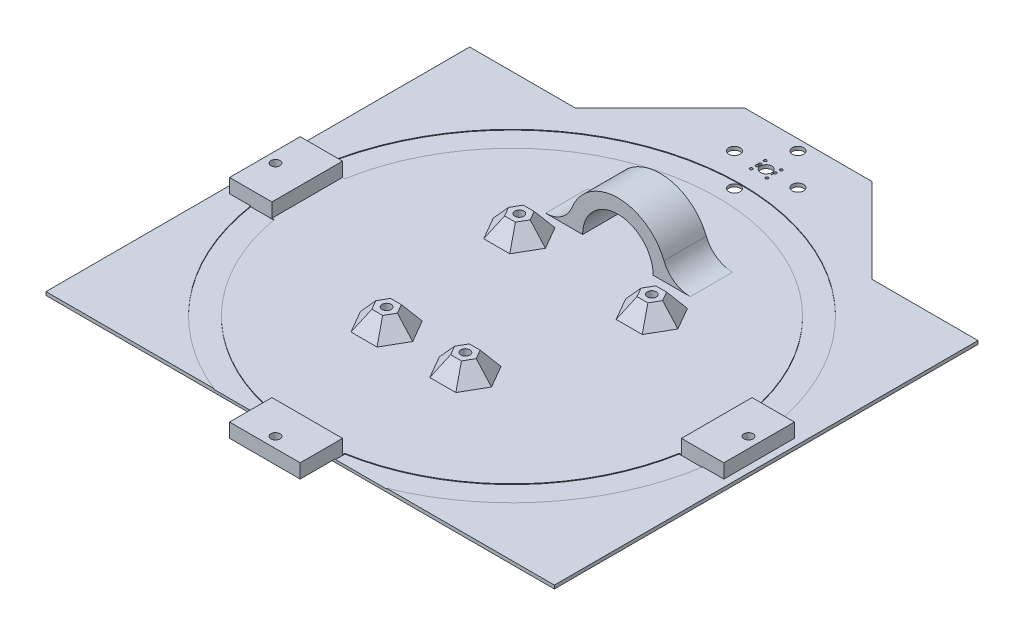
from build123d import *

# Parameters (mm, degrees)
SKETCH1_W                = 180
SKETCH1_H                = 150
BOSS_EXTRUDE1_DEPTH      = 1.2
BOSS_EXTRUDE2_DEPTH      = 6
CHAMFER1_SIZE            = 5
CHAMFER1_SIZE_2          = 6.399708161
SKETCH3_R                = 1.6
CUT_EXTRUDE1_DEPTH       = 5
SKETCH4_W                = 15
SKETCH4_H                = 25
SKETCH4_R                = 1.6
SKETCH4_W_2              = 25
SKETCH4_H_2              = 15
BOSS_EXTRUDE3_DEPTH      = 5
CUT_EXTRUDE2_DEPTH       = 0.25
BOSS_EXTRUDE4_DEPTH      = 7.5
BOSS_EXTRUDE4_DEPTH_BACK = 7.5
FILLET1_R                = 10
CUT_EXTRUDE3_REACH       = 141.552
SKETCH7_R                = 2
SKETCH7_R_2              = 0.5


with BuildPart() as part:
    # Sketch1 → Boss-Extrude1 (new body)
    with BuildSketch(Plane(origin=(0, 0, 0), x_dir=(1, 0, 0), z_dir=(0, 1, 0))):
        Rectangle(SKETCH1_W, SKETCH1_H)
        Polygon((-52.5, 75), (0, 75), (0, 105), (-22.5, 105), align=None)
        Polygon((0, 105), (0, 75), (52.5, 75), (22.5, 105), align=None)
    extrude(amount=BOSS_EXTRUDE1_DEPTH)

    # Sketch2 → Boss-Extrude2 (add)
    with BuildSketch(Plane(origin=(0, 1.2, 0), x_dir=(1, 0, 0), z_dir=(0, 1, 0))):
        Polygon((27.564101615, 25.4), (25.832050808, 28.4), (22.367949192, 28.4), (20.635898385, 25.4), (22.367949192, 22.4), (25.832050808, 22.4), align=None)
        Polygon((-20.635898385, 26.7), (-22.367949192, 29.7), (-25.832050808, 29.7), (-27.564101615, 26.7), (-25.832050808, 23.7), (-22.367949192, 23.7), align=None)
        Polygon((-15.535898385, -25.4), (-17.267949192, -22.4), (-20.732050808, -22.4), (-22.464101615, -25.4), (-20.732050808, -28.4), (-17.267949192, -28.4), align=None)
        Polygon((12.364101615, -25.4), (10.632050808, -22.4), (7.167949192, -22.4), (5.435898385, -25.4), (7.167949192, -28.4), (10.632050808, -28.4), align=None)
    extrude(amount=BOSS_EXTRUDE2_DEPTH)

    # Chamfer1
    # the kernel refuses this chamfer: 6.399708161, 5 mm, written as the material it adds along each edge
    with BuildSketch(Plane(origin=(-2.818240039, 1.2, 11.103412877), x_dir=(-0.8660254037844387, 0, 0.5), z_dir=(0.5, 0, 0.8660254037844387))) as chamfer1_piece_1_section:
        Polygon((CHAMFER1_SIZE, 0), (0, -CHAMFER1_SIZE_2), (0, 0), align=None)
    chamfer1_piece_1 = extrude(amount=36.480655312, mode=Mode.PRIVATE)
    chamfer1_piece_1 = split(chamfer1_piece_1, bisect_by=Plane(origin=(-2.818240039, 7.2, 11.103412877), z_dir=(0, -1, 0)), keep=Keep.TOP, mode=Mode.PRIVATE)
    chamfer1_piece_1 = split(chamfer1_piece_1, bisect_by=Plane(origin=(2.181166612, -3.310219377, 13.989821652), z_dir=(0.6824373310787425, -0.6156614753256566, 0.3940053768033616)), keep=Keep.TOP, mode=Mode.PRIVATE)
    chamfer1_piece_1 = split(chamfer1_piece_1, bisect_by=Plane(origin=(-2.818240039, 12.017141598, 24.948722749), z_dir=(0, -0.6156614753256563, -0.7880107536067237)), keep=Keep.TOP, mode=Mode.PRIVATE)
    add(chamfer1_piece_1)
    with BuildSketch(Plane(origin=(15.422087617, 1.2, 8.103412877), x_dir=(-0.8660254037844387, 0, -0.4999999999999999), z_dir=(-0.4999999999999999, 0, 0.8660254037844388))) as chamfer1_piece_2_section:
        Polygon((CHAMFER1_SIZE, 0), (0, -CHAMFER1_SIZE_2), (0, 0), align=None)
    chamfer1_piece_2 = extrude(amount=36.480655312, mode=Mode.PRIVATE)
    chamfer1_piece_2 = split(chamfer1_piece_2, bisect_by=Plane(origin=(15.422087617, 7.2, 8.103412877), z_dir=(0, -1, 0)), keep=Keep.TOP, mode=Mode.PRIVATE)
    chamfer1_piece_2 = split(chamfer1_piece_2, bisect_by=Plane(origin=(15.422087617, -3.310219377, 13.876230428), z_dir=(0, -0.6156614753256565, 0.7880107536067235)), keep=Keep.TOP, mode=Mode.PRIVATE)
    chamfer1_piece_2 = split(chamfer1_piece_2, bisect_by=Plane(origin=(3.431697543, 12.017141598, 15.026067813), z_dir=(0.6824373310787425, -0.6156614753256566, -0.3940053768033616)), keep=Keep.TOP, mode=Mode.PRIVATE)
    add(chamfer1_piece_2)
    with BuildSketch(Plane(origin=(27.140327656, 1.2, 22.4), x_dir=(0, 0, -1), z_dir=(-1, 0, 0))) as chamfer1_piece_3_section:
        Polygon((CHAMFER1_SIZE, 0), (0, -CHAMFER1_SIZE_2), (0, 0), align=None)
    chamfer1_piece_3 = extrude(amount=36.480655312, mode=Mode.PRIVATE)
    chamfer1_piece_3 = split(chamfer1_piece_3, bisect_by=Plane(origin=(27.140327656, 7.2, 22.4), z_dir=(0, -1, 0)), keep=Keep.TOP, mode=Mode.PRIVATE)
    chamfer1_piece_3 = split(chamfer1_piece_3, bisect_by=Plane(origin=(22.140921005, -3.310219377, 25.286408776), z_dir=(-0.6824373310787424, -0.6156614753256568, 0.39400537680336145)), keep=Keep.TOP, mode=Mode.PRIVATE)
    chamfer1_piece_3 = split(chamfer1_piece_3, bisect_by=Plane(origin=(15.149937583, 12.017141598, 15.477345064), z_dir=(0.6824373310787425, -0.6156614753256566, 0.3940053768033616)), keep=Keep.TOP, mode=Mode.PRIVATE)
    add(chamfer1_piece_3)
    with BuildSketch(Plane(origin=(20.618240039, 1.2, 39.696587123), x_dir=(0.8660254037844387, 0, -0.49999999999999983), z_dir=(-0.4999999999999998, 0, -0.8660254037844388))) as chamfer1_piece_4_section:
        Polygon((CHAMFER1_SIZE, 0), (0, -CHAMFER1_SIZE_2), (0, 0), align=None)
    chamfer1_piece_4 = extrude(amount=36.480655312, mode=Mode.PRIVATE)
    chamfer1_piece_4 = split(chamfer1_piece_4, bisect_by=Plane(origin=(20.618240039, 7.2, 39.696587123), z_dir=(0, -1, 0)), keep=Keep.TOP, mode=Mode.PRIVATE)
    chamfer1_piece_4 = split(chamfer1_piece_4, bisect_by=Plane(origin=(20.618240039, 12.017141598, 25.851277251), z_dir=(0, -0.6156614753256565, 0.7880107536067235)), keep=Keep.TOP, mode=Mode.PRIVATE)
    chamfer1_piece_4 = split(chamfer1_piece_4, bisect_by=Plane(origin=(15.618833388, -3.310219377, 36.810178348), z_dir=(-0.6824373310787425, -0.6156614753256566, -0.39400537680336156)), keep=Keep.TOP, mode=Mode.PRIVATE)
    add(chamfer1_piece_4)
    with BuildSketch(Plane(origin=(2.377912383, 1.2, 42.696587123), x_dir=(0.8660254037844387, 0, 0.4999999999999999), z_dir=(0.4999999999999999, 0, -0.8660254037844388))) as chamfer1_piece_5_section:
        Polygon((CHAMFER1_SIZE, 0), (0, -CHAMFER1_SIZE_2), (0, 0), align=None)
    chamfer1_piece_5 = extrude(amount=36.480655312, mode=Mode.PRIVATE)
    chamfer1_piece_5 = split(chamfer1_piece_5, bisect_by=Plane(origin=(2.377912383, 7.2, 42.696587123), z_dir=(0, -1, 0)), keep=Keep.TOP, mode=Mode.PRIVATE)
    chamfer1_piece_5 = split(chamfer1_piece_5, bisect_by=Plane(origin=(14.368302457, 12.017141598, 35.773932187), z_dir=(-0.6824373310787424, -0.6156614753256568, 0.39400537680336145)), keep=Keep.TOP, mode=Mode.PRIVATE)
    chamfer1_piece_5 = split(chamfer1_piece_5, bisect_by=Plane(origin=(2.377912383, -3.310219377, 36.923769572), z_dir=(0, -0.6156614753256563, -0.7880107536067237)), keep=Keep.TOP, mode=Mode.PRIVATE)
    add(chamfer1_piece_5)
    with BuildSketch(Plane(origin=(-9.340327656, 1.2, 28.4), x_dir=(0, 0, 1), z_dir=(1, 0, 0))) as chamfer1_piece_6_section:
        Polygon((CHAMFER1_SIZE, 0), (0, -CHAMFER1_SIZE_2), (0, 0), align=None)
    chamfer1_piece_6 = extrude(amount=36.480655312, mode=Mode.PRIVATE)
    chamfer1_piece_6 = split(chamfer1_piece_6, bisect_by=Plane(origin=(-9.340327656, 7.2, 28.4), z_dir=(0, -1, 0)), keep=Keep.TOP, mode=Mode.PRIVATE)
    chamfer1_piece_6 = split(chamfer1_piece_6, bisect_by=Plane(origin=(-4.340921005, -3.310219377, 25.513591224), z_dir=(0.6824373310787425, -0.6156614753256566, -0.3940053768033616)), keep=Keep.TOP, mode=Mode.PRIVATE)
    chamfer1_piece_6 = split(chamfer1_piece_6, bisect_by=Plane(origin=(2.650062417, 12.017141598, 35.322654936), z_dir=(-0.6824373310787425, -0.6156614753256566, -0.39400537680336156)), keep=Keep.TOP, mode=Mode.PRIVATE)
    add(chamfer1_piece_6)
    with BuildSketch(Plane(origin=(-37.240327656, 1.2, 28.4), x_dir=(0, 0, 1), z_dir=(1, 0, 0))) as chamfer1_piece_7_section:
        Polygon((CHAMFER1_SIZE, 0), (0, -CHAMFER1_SIZE_2), (0, 0), align=None)
    chamfer1_piece_7 = extrude(amount=36.480655312, mode=Mode.PRIVATE)
    chamfer1_piece_7 = split(chamfer1_piece_7, bisect_by=Plane(origin=(-37.240327656, 7.2, 28.4), z_dir=(0, -1, 0)), keep=Keep.TOP, mode=Mode.PRIVATE)
    chamfer1_piece_7 = split(chamfer1_piece_7, bisect_by=Plane(origin=(-25.249937583, 12.017141598, 35.322654936), z_dir=(-0.6824373310786762, -0.6156614753256564, -0.3940053768034766)), keep=Keep.TOP, mode=Mode.PRIVATE)
    chamfer1_piece_7 = split(chamfer1_piece_7, bisect_by=Plane(origin=(-32.240921005, -3.310219377, 25.513591224), z_dir=(0.6824373310787202, -0.6156614753256564, -0.3940053768034006)), keep=Keep.TOP, mode=Mode.PRIVATE)
    add(chamfer1_piece_7)
    with BuildSketch(Plane(origin=(-25.522087617, 1.2, 42.696587123), x_dir=(0.8660254037843544, 0, 0.5000000000001458), z_dir=(0.5000000000001458, 0, -0.8660254037843546))) as chamfer1_piece_8_section:
        Polygon((CHAMFER1_SIZE, 0), (0, -CHAMFER1_SIZE_2), (0, 0), align=None)
    chamfer1_piece_8 = extrude(amount=36.480655312, mode=Mode.PRIVATE)
    chamfer1_piece_8 = split(chamfer1_piece_8, bisect_by=Plane(origin=(-25.522087617, 7.2, 42.696587123), z_dir=(0, -1, 0)), keep=Keep.TOP, mode=Mode.PRIVATE)
    chamfer1_piece_8 = split(chamfer1_piece_8, bisect_by=Plane(origin=(-25.522087617, -3.310219377, 36.923769572), z_dir=(0, -0.6156614753256567, -0.7880107536067232)), keep=Keep.TOP, mode=Mode.PRIVATE)
    chamfer1_piece_8 = split(chamfer1_piece_8, bisect_by=Plane(origin=(-13.531697543, 12.017141598, 35.773932187), z_dir=(-0.6824373310787424, -0.6156614753256564, 0.39400537680336184)), keep=Keep.TOP, mode=Mode.PRIVATE)
    add(chamfer1_piece_8)
    with BuildSketch(Plane(origin=(-7.281759961, 1.2, 39.696587123), x_dir=(0.8660254037844386, 0, -0.5000000000000001), z_dir=(-0.5000000000000001, 0, -0.8660254037844386))) as chamfer1_piece_9_section:
        Polygon((CHAMFER1_SIZE, 0), (0, -CHAMFER1_SIZE_2), (0, 0), align=None)
    chamfer1_piece_9 = extrude(amount=36.480655312, mode=Mode.PRIVATE)
    chamfer1_piece_9 = split(chamfer1_piece_9, bisect_by=Plane(origin=(-7.281759961, 7.2, 39.696587123), z_dir=(0, -1, 0)), keep=Keep.TOP, mode=Mode.PRIVATE)
    chamfer1_piece_9 = split(chamfer1_piece_9, bisect_by=Plane(origin=(-12.281166612, -3.310219377, 36.810178348), z_dir=(-0.6824373310786762, -0.6156614753256564, -0.3940053768034766)), keep=Keep.TOP, mode=Mode.PRIVATE)
    chamfer1_piece_9 = split(chamfer1_piece_9, bisect_by=Plane(origin=(-7.281759961, 12.017141598, 25.851277251), z_dir=(1.6163362940315776e-14, -0.6156614753256565, 0.7880107536067235)), keep=Keep.TOP, mode=Mode.PRIVATE)
    add(chamfer1_piece_9)
    with BuildSketch(Plane(origin=(-0.759672344, 1.2, 22.4), x_dir=(0, 0, -1), z_dir=(-1, 0, 0))) as chamfer1_piece_10_section:
        Polygon((CHAMFER1_SIZE, 0), (0, -CHAMFER1_SIZE_2), (0, 0), align=None)
    chamfer1_piece_10 = extrude(amount=36.480655312, mode=Mode.PRIVATE)
    chamfer1_piece_10 = split(chamfer1_piece_10, bisect_by=Plane(origin=(-0.759672344, 7.2, 22.4), z_dir=(0, -1, 0)), keep=Keep.TOP, mode=Mode.PRIVATE)
    chamfer1_piece_10 = split(chamfer1_piece_10, bisect_by=Plane(origin=(-5.759078995, -3.310219377, 25.286408776), z_dir=(-0.6824373310787424, -0.6156614753256564, 0.39400537680336184)), keep=Keep.TOP, mode=Mode.PRIVATE)
    chamfer1_piece_10 = split(chamfer1_piece_10, bisect_by=Plane(origin=(-12.750062417, 12.017141598, 15.477345064), z_dir=(0.6824373310787266, -0.6156614753256564, 0.3940053768033893)), keep=Keep.TOP, mode=Mode.PRIVATE)
    add(chamfer1_piece_10)
    with BuildSketch(Plane(origin=(-12.477912383, 1.2, 8.103412877), x_dir=(-0.8660254037844184, 0, -0.500000000000035), z_dir=(-0.500000000000035, 0, 0.8660254037844185))) as chamfer1_piece_11_section:
        Polygon((CHAMFER1_SIZE, 0), (0, -CHAMFER1_SIZE_2), (0, 0), align=None)
    chamfer1_piece_11 = extrude(amount=36.480655312, mode=Mode.PRIVATE)
    chamfer1_piece_11 = split(chamfer1_piece_11, bisect_by=Plane(origin=(-12.477912383, 7.2, 8.103412877), z_dir=(0, -1, 0)), keep=Keep.TOP, mode=Mode.PRIVATE)
    chamfer1_piece_11 = split(chamfer1_piece_11, bisect_by=Plane(origin=(-12.477912383, -3.310219377, 13.876230428), z_dir=(1.6163362940315776e-14, -0.6156614753256565, 0.7880107536067235)), keep=Keep.TOP, mode=Mode.PRIVATE)
    chamfer1_piece_11 = split(chamfer1_piece_11, bisect_by=Plane(origin=(-24.468302457, 12.017141598, 15.026067813), z_dir=(0.6824373310787202, -0.6156614753256564, -0.3940053768034006)), keep=Keep.TOP, mode=Mode.PRIVATE)
    add(chamfer1_piece_11)
    with BuildSketch(Plane(origin=(-30.718240039, 1.2, 11.103412877), x_dir=(-0.8660254037844104, 0, 0.5000000000000491), z_dir=(0.5000000000000491, 0, 0.8660254037844103))) as chamfer1_piece_12_section:
        Polygon((CHAMFER1_SIZE, 0), (0, -CHAMFER1_SIZE_2), (0, 0), align=None)
    chamfer1_piece_12 = extrude(amount=36.480655312, mode=Mode.PRIVATE)
    chamfer1_piece_12 = split(chamfer1_piece_12, bisect_by=Plane(origin=(-30.718240039, 7.2, 11.103412877), z_dir=(0, -1, 0)), keep=Keep.TOP, mode=Mode.PRIVATE)
    chamfer1_piece_12 = split(chamfer1_piece_12, bisect_by=Plane(origin=(-30.718240039, 12.017141598, 24.948722749), z_dir=(0, -0.6156614753256567, -0.7880107536067232)), keep=Keep.TOP, mode=Mode.PRIVATE)
    chamfer1_piece_12 = split(chamfer1_piece_12, bisect_by=Plane(origin=(-25.718833388, -3.310219377, 13.989821652), z_dir=(0.6824373310787266, -0.6156614753256564, 0.3940053768033893)), keep=Keep.TOP, mode=Mode.PRIVATE)
    add(chamfer1_piece_12)
    with BuildSketch(Plane(origin=(30.622087617, 1.2, -42.696587123), x_dir=(-0.8660254037844389, 0, -0.49999999999999956), z_dir=(-0.4999999999999995, 0, 0.8660254037844389))) as chamfer1_piece_13_section:
        Polygon((CHAMFER1_SIZE, 0), (0, -CHAMFER1_SIZE_2), (0, 0), align=None)
    chamfer1_piece_13 = extrude(amount=36.480655312, mode=Mode.PRIVATE)
    chamfer1_piece_13 = split(chamfer1_piece_13, bisect_by=Plane(origin=(30.622087617, 7.2, -42.696587123), z_dir=(0, -1, 0)), keep=Keep.TOP, mode=Mode.PRIVATE)
    chamfer1_piece_13 = split(chamfer1_piece_13, bisect_by=Plane(origin=(18.631697543, 12.017141598, -35.773932187), z_dir=(0.6824373310787425, -0.6156614753256566, -0.3940053768033616)), keep=Keep.TOP, mode=Mode.PRIVATE)
    chamfer1_piece_13 = split(chamfer1_piece_13, bisect_by=Plane(origin=(30.622087617, -3.310219377, -36.923769572), z_dir=(0, -0.6156614753256565, 0.7880107536067235)), keep=Keep.TOP, mode=Mode.PRIVATE)
    add(chamfer1_piece_13)
    with BuildSketch(Plane(origin=(12.381759961, 1.2, -39.696587123), x_dir=(-0.8660254037844387, 0, 0.4999999999999999), z_dir=(0.4999999999999999, 0, 0.8660254037844388))) as chamfer1_piece_14_section:
        Polygon((CHAMFER1_SIZE, 0), (0, -CHAMFER1_SIZE_2), (0, 0), align=None)
    chamfer1_piece_14 = extrude(amount=36.480655312, mode=Mode.PRIVATE)
    chamfer1_piece_14 = split(chamfer1_piece_14, bisect_by=Plane(origin=(12.381759961, 7.2, -39.696587123), z_dir=(0, -1, 0)), keep=Keep.TOP, mode=Mode.PRIVATE)
    chamfer1_piece_14 = split(chamfer1_piece_14, bisect_by=Plane(origin=(17.381166612, -3.310219377, -36.810178348), z_dir=(0.6824373310787428, -0.6156614753256567, 0.39400537680336145)), keep=Keep.TOP, mode=Mode.PRIVATE)
    chamfer1_piece_14 = split(chamfer1_piece_14, bisect_by=Plane(origin=(12.381759961, 12.017141598, -25.851277251), z_dir=(0, -0.6156614753256565, -0.7880107536067235)), keep=Keep.TOP, mode=Mode.PRIVATE)
    add(chamfer1_piece_14)
    with BuildSketch(Plane(origin=(5.859672344, 1.2, -22.4), x_dir=(0, 0, 1), z_dir=(1, 0, 0))) as chamfer1_piece_15_section:
        Polygon((CHAMFER1_SIZE, 0), (0, -CHAMFER1_SIZE_2), (0, 0), align=None)
    chamfer1_piece_15 = extrude(amount=36.480655312, mode=Mode.PRIVATE)
    chamfer1_piece_15 = split(chamfer1_piece_15, bisect_by=Plane(origin=(5.859672344, 7.2, -22.4), z_dir=(0, -1, 0)), keep=Keep.TOP, mode=Mode.PRIVATE)
    chamfer1_piece_15 = split(chamfer1_piece_15, bisect_by=Plane(origin=(10.859078995, -3.310219377, -25.286408776), z_dir=(0.6824373310787425, -0.6156614753256566, -0.3940053768033616)), keep=Keep.TOP, mode=Mode.PRIVATE)
    chamfer1_piece_15 = split(chamfer1_piece_15, bisect_by=Plane(origin=(17.850062417, 12.017141598, -15.477345064), z_dir=(-0.6824373310787426, -0.6156614753256564, -0.39400537680336173)), keep=Keep.TOP, mode=Mode.PRIVATE)
    add(chamfer1_piece_15)
    with BuildSketch(Plane(origin=(17.577912383, 1.2, -8.103412877), x_dir=(0.8660254037844387, 0, 0.4999999999999999), z_dir=(0.4999999999999999, 0, -0.8660254037844388))) as chamfer1_piece_16_section:
        Polygon((CHAMFER1_SIZE, 0), (0, -CHAMFER1_SIZE_2), (0, 0), align=None)
    chamfer1_piece_16 = extrude(amount=36.480655312, mode=Mode.PRIVATE)
    chamfer1_piece_16 = split(chamfer1_piece_16, bisect_by=Plane(origin=(17.577912383, 7.2, -8.103412877), z_dir=(0, -1, 0)), keep=Keep.TOP, mode=Mode.PRIVATE)
    chamfer1_piece_16 = split(chamfer1_piece_16, bisect_by=Plane(origin=(17.577912383, -3.310219377, -13.876230428), z_dir=(0, -0.6156614753256565, -0.7880107536067235)), keep=Keep.TOP, mode=Mode.PRIVATE)
    chamfer1_piece_16 = split(chamfer1_piece_16, bisect_by=Plane(origin=(29.568302457, 12.017141598, -15.026067813), z_dir=(-0.6824373310787424, -0.6156614753256564, 0.3940053768033619)), keep=Keep.TOP, mode=Mode.PRIVATE)
    add(chamfer1_piece_16)
    with BuildSketch(Plane(origin=(35.818240039, 1.2, -11.103412877), x_dir=(0.8660254037844385, 0, -0.5000000000000002), z_dir=(-0.5000000000000003, 0, -0.8660254037844386))) as chamfer1_piece_17_section:
        Polygon((CHAMFER1_SIZE, 0), (0, -CHAMFER1_SIZE_2), (0, 0), align=None)
    chamfer1_piece_17 = extrude(amount=36.480655312, mode=Mode.PRIVATE)
    chamfer1_piece_17 = split(chamfer1_piece_17, bisect_by=Plane(origin=(35.818240039, 7.2, -11.103412877), z_dir=(0, -1, 0)), keep=Keep.TOP, mode=Mode.PRIVATE)
    chamfer1_piece_17 = split(chamfer1_piece_17, bisect_by=Plane(origin=(30.818833388, -3.310219377, -13.989821652), z_dir=(-0.6824373310787426, -0.6156614753256564, -0.39400537680336173)), keep=Keep.TOP, mode=Mode.PRIVATE)
    chamfer1_piece_17 = split(chamfer1_piece_17, bisect_by=Plane(origin=(35.818240039, 12.017141598, -24.948722749), z_dir=(0, -0.6156614753256565, 0.7880107536067235)), keep=Keep.TOP, mode=Mode.PRIVATE)
    add(chamfer1_piece_17)
    with BuildSketch(Plane(origin=(42.340327656, 1.2, -28.4), x_dir=(0, 0, -1), z_dir=(-1, 0, 0))) as chamfer1_piece_18_section:
        Polygon((CHAMFER1_SIZE, 0), (0, -CHAMFER1_SIZE_2), (0, 0), align=None)
    chamfer1_piece_18 = extrude(amount=36.480655312, mode=Mode.PRIVATE)
    chamfer1_piece_18 = split(chamfer1_piece_18, bisect_by=Plane(origin=(42.340327656, 7.2, -28.4), z_dir=(0, -1, 0)), keep=Keep.TOP, mode=Mode.PRIVATE)
    chamfer1_piece_18 = split(chamfer1_piece_18, bisect_by=Plane(origin=(30.349937583, 12.017141598, -35.322654936), z_dir=(0.6824373310787428, -0.6156614753256567, 0.39400537680336145)), keep=Keep.TOP, mode=Mode.PRIVATE)
    chamfer1_piece_18 = split(chamfer1_piece_18, bisect_by=Plane(origin=(37.340921005, -3.310219377, -25.513591224), z_dir=(-0.6824373310787424, -0.6156614753256564, 0.3940053768033619)), keep=Keep.TOP, mode=Mode.PRIVATE)
    add(chamfer1_piece_18)
    with BuildSketch(Plane(origin=(-17.577912383, 1.2, -43.996587123), x_dir=(-0.8660254037844387, 0, -0.4999999999999999), z_dir=(-0.4999999999999999, 0, 0.8660254037844388))) as chamfer1_piece_19_section:
        Polygon((CHAMFER1_SIZE, 0), (0, -CHAMFER1_SIZE_2), (0, 0), align=None)
    chamfer1_piece_19 = extrude(amount=36.480655312, mode=Mode.PRIVATE)
    chamfer1_piece_19 = split(chamfer1_piece_19, bisect_by=Plane(origin=(-17.577912383, 7.2, -43.996587123), z_dir=(0, -1, 0)), keep=Keep.TOP, mode=Mode.PRIVATE)
    chamfer1_piece_19 = split(chamfer1_piece_19, bisect_by=Plane(origin=(-17.577912383, -3.310219377, -38.223769572), z_dir=(0, -0.6156614753256565, 0.7880107536067235)), keep=Keep.TOP, mode=Mode.PRIVATE)
    chamfer1_piece_19 = split(chamfer1_piece_19, bisect_by=Plane(origin=(-29.568302457, 12.017141598, -37.073932187), z_dir=(0.6824373310787425, -0.6156614753256564, -0.394005376803362)), keep=Keep.TOP, mode=Mode.PRIVATE)
    add(chamfer1_piece_19)
    with BuildSketch(Plane(origin=(-5.859672344, 1.2, -29.7), x_dir=(0, 0, -1), z_dir=(-1, 0, 0))) as chamfer1_piece_20_section:
        Polygon((CHAMFER1_SIZE, 0), (0, -CHAMFER1_SIZE_2), (0, 0), align=None)
    chamfer1_piece_20 = extrude(amount=36.480655312, mode=Mode.PRIVATE)
    chamfer1_piece_20 = split(chamfer1_piece_20, bisect_by=Plane(origin=(-5.859672344, 7.2, -29.7), z_dir=(0, -1, 0)), keep=Keep.TOP, mode=Mode.PRIVATE)
    chamfer1_piece_20 = split(chamfer1_piece_20, bisect_by=Plane(origin=(-10.859078995, -3.310219377, -26.813591224), z_dir=(-0.682437331078742, -0.6156614753256566, 0.39400537680336195)), keep=Keep.TOP, mode=Mode.PRIVATE)
    chamfer1_piece_20 = split(chamfer1_piece_20, bisect_by=Plane(origin=(-17.850062417, 12.017141598, -36.622654936), z_dir=(0.6824373310787424, -0.615661475325657, 0.3940053768033615)), keep=Keep.TOP, mode=Mode.PRIVATE)
    add(chamfer1_piece_20)
    with BuildSketch(Plane(origin=(-12.381759961, 1.2, -12.403412877), x_dir=(0.8660254037844385, 0, -0.5000000000000004), z_dir=(-0.5000000000000004, 0, -0.8660254037844385))) as chamfer1_piece_21_section:
        Polygon((CHAMFER1_SIZE, 0), (0, -CHAMFER1_SIZE_2), (0, 0), align=None)
    chamfer1_piece_21 = extrude(amount=36.480655312, mode=Mode.PRIVATE)
    chamfer1_piece_21 = split(chamfer1_piece_21, bisect_by=Plane(origin=(-12.381759961, 7.2, -12.403412877), z_dir=(0, -1, 0)), keep=Keep.TOP, mode=Mode.PRIVATE)
    chamfer1_piece_21 = split(chamfer1_piece_21, bisect_by=Plane(origin=(-12.381759961, 12.017141598, -26.248722749), z_dir=(0, -0.6156614753256565, 0.7880107536067235)), keep=Keep.TOP, mode=Mode.PRIVATE)
    chamfer1_piece_21 = split(chamfer1_piece_21, bisect_by=Plane(origin=(-17.381166612, -3.310219377, -15.289821652), z_dir=(-0.6824373310787428, -0.6156614753256568, -0.39400537680336084)), keep=Keep.TOP, mode=Mode.PRIVATE)
    add(chamfer1_piece_21)
    with BuildSketch(Plane(origin=(-30.622087617, 1.2, -9.403412877), x_dir=(0.8660254037844393, 0, 0.49999999999999895), z_dir=(0.499999999999999, 0, -0.8660254037844394))) as chamfer1_piece_22_section:
        Polygon((CHAMFER1_SIZE, 0), (0, -CHAMFER1_SIZE_2), (0, 0), align=None)
    chamfer1_piece_22 = extrude(amount=36.480655312, mode=Mode.PRIVATE)
    chamfer1_piece_22 = split(chamfer1_piece_22, bisect_by=Plane(origin=(-30.622087617, 7.2, -9.403412877), z_dir=(0, -1, 0)), keep=Keep.TOP, mode=Mode.PRIVATE)
    chamfer1_piece_22 = split(chamfer1_piece_22, bisect_by=Plane(origin=(-18.631697543, 12.017141598, -16.326067813), z_dir=(-0.682437331078742, -0.6156614753256566, 0.39400537680336195)), keep=Keep.TOP, mode=Mode.PRIVATE)
    chamfer1_piece_22 = split(chamfer1_piece_22, bisect_by=Plane(origin=(-30.622087617, -3.310219377, -15.176230428), z_dir=(0, -0.6156614753256565, -0.7880107536067235)), keep=Keep.TOP, mode=Mode.PRIVATE)
    add(chamfer1_piece_22)
    with BuildSketch(Plane(origin=(-42.340327656, 1.2, -23.7), x_dir=(0, 0, 1), z_dir=(1, 0, 0))) as chamfer1_piece_23_section:
        Polygon((CHAMFER1_SIZE, 0), (0, -CHAMFER1_SIZE_2), (0, 0), align=None)
    chamfer1_piece_23 = extrude(amount=36.480655312, mode=Mode.PRIVATE)
    chamfer1_piece_23 = split(chamfer1_piece_23, bisect_by=Plane(origin=(-42.340327656, 7.2, -23.7), z_dir=(0, -1, 0)), keep=Keep.TOP, mode=Mode.PRIVATE)
    chamfer1_piece_23 = split(chamfer1_piece_23, bisect_by=Plane(origin=(-37.340921005, -3.310219377, -26.586408776), z_dir=(0.6824373310787425, -0.6156614753256564, -0.394005376803362)), keep=Keep.TOP, mode=Mode.PRIVATE)
    chamfer1_piece_23 = split(chamfer1_piece_23, bisect_by=Plane(origin=(-30.349937583, 12.017141598, -16.777345064), z_dir=(-0.6824373310787428, -0.6156614753256568, -0.39400537680336084)), keep=Keep.TOP, mode=Mode.PRIVATE)
    add(chamfer1_piece_23)
    with BuildSketch(Plane(origin=(-35.818240039, 1.2, -40.996587123), x_dir=(-0.8660254037844385, 0, 0.5000000000000002), z_dir=(0.5000000000000003, 0, 0.8660254037844386))) as chamfer1_piece_24_section:
        Polygon((CHAMFER1_SIZE, 0), (0, -CHAMFER1_SIZE_2), (0, 0), align=None)
    chamfer1_piece_24 = extrude(amount=36.480655312, mode=Mode.PRIVATE)
    chamfer1_piece_24 = split(chamfer1_piece_24, bisect_by=Plane(origin=(-35.818240039, 7.2, -40.996587123), z_dir=(0, -1, 0)), keep=Keep.TOP, mode=Mode.PRIVATE)
    chamfer1_piece_24 = split(chamfer1_piece_24, bisect_by=Plane(origin=(-30.818833388, -3.310219377, -38.110178348), z_dir=(0.6824373310787424, -0.615661475325657, 0.3940053768033615)), keep=Keep.TOP, mode=Mode.PRIVATE)
    chamfer1_piece_24 = split(chamfer1_piece_24, bisect_by=Plane(origin=(-35.818240039, 12.017141598, -27.151277251), z_dir=(0, -0.6156614753256565, -0.7880107536067235)), keep=Keep.TOP, mode=Mode.PRIVATE)
    add(chamfer1_piece_24)

    # Sketch3 → Cut-Extrude1 (cut)
    with BuildSketch(Plane(origin=(0, 7.2, 0), x_dir=(1, 0, 0), z_dir=(0, 1, 0))):
        with Locations(Location((24.1, 25.4, 0), (0, 0, 270))):
            Circle(SKETCH3_R)
        with Locations(Location((-19, -25.4, 0), (0, 0, 270))):
            Circle(SKETCH3_R)
        with Locations(Location((8.9, -25.4, 0), (0, 0, 270))):
            Circle(SKETCH3_R)
        with Locations(Location((-24.1, 26.7, 0), (0, 0, 270))):
            Circle(SKETCH3_R)
    extrude(amount=-CUT_EXTRUDE1_DEPTH, mode=Mode.SUBTRACT)

    # Sketch4 → Boss-Extrude3 (add)
    # profile 1 of 3: a face of its own
    with BuildSketch(Plane(origin=(0, 1.2, 0), x_dir=(1, 0, 0), z_dir=(0, 1, 0))):
        with Locations((80, 0)):
            Rectangle(SKETCH4_W, SKETCH4_H)
        with Locations(Location((83.75, 0, 0), (0, 0, 270))):
            Circle(SKETCH4_R, mode=Mode.SUBTRACT)
    # profile 2 of 3: a face of its own
    with BuildSketch(Plane(origin=(0, 1.2, 0), x_dir=(1, 0, 0), z_dir=(0, 1, 0))):
        with Locations((0, -80)):
            Rectangle(SKETCH4_W_2, SKETCH4_H_2)
        with Locations(Location((0, -83.75, 0), (0, 0, 270))):
            Circle(SKETCH4_R, mode=Mode.SUBTRACT)
    # profile 3 of 3: a face of its own
    with BuildSketch(Plane(origin=(0, 1.2, 0), x_dir=(1, 0, 0), z_dir=(0, 1, 0))):
        with Locations((-80, 0)):
            Rectangle(SKETCH4_W, SKETCH4_H)
        with Locations(Location((-83.75, 0, 0), (0, 0, 270))):
            Circle(SKETCH4_R, mode=Mode.SUBTRACT)
    extrude(amount=BOSS_EXTRUDE3_DEPTH)

    # Sketch5 → Cut-Extrude2 (cut)
    with BuildSketch(Plane(origin=(0, 1.2, 0), x_dir=(1, 0, 0), z_dir=(0, 1, 0))):
        with BuildLine():
            Line((-80.029681994, 12.5), (-71.681918175, 12.5))
            ThreePointArc((-71.681918175, 12.5), (0, 72.763640599), (71.681918175, 12.5))
            Line((71.681918175, 12.5), (80.029681994, 12.5))
            ThreePointArc((80.029681994, 12.5), (0, 81), (-80.029681994, 12.5))
        make_face()
        with BuildLine():
            Line((-71.681918175, -12.5), (-80.029681994, -12.5))
            ThreePointArc((-80.029681994, -12.5), (-63.529274594, -50.249689248), (-30.594117082, -75))
            Line((-30.594117082, -75), (-12.5, -75))
            Line((-12.5, -75), (-12.5, -72.5))
            Line((-12.5, -72.5), (-6.188488771, -72.5))
            ThreePointArc((-6.188488771, -72.5), (-49.152314996, -53.652561204), (-71.681918175, -12.5))
        make_face()
        with BuildLine():
            ThreePointArc((30.594117082, -75), (63.529274594, -50.249689248), (80.029681994, -12.5))
            Line((80.029681994, -12.5), (71.681918175, -12.5))
            ThreePointArc((71.681918175, -12.5), (51.451663692, -51.451663692), (12.5, -71.681918175))
            Line((12.5, -71.681918175), (12.5, -75))
            Line((12.5, -75), (30.594117082, -75))
        make_face()
    extrude(amount=-CUT_EXTRUDE2_DEPTH, mode=Mode.SUBTRACT)

    # Sketch6 → Boss-Extrude4 (add, two sides: drawn at the far end of the back side and taken through both)
    with BuildSketch(Plane(origin=(0, 0, -45), x_dir=(-1, 0, 0), z_dir=(0, 0, -1)).offset(-BOSS_EXTRUDE4_DEPTH_BACK)):
        with BuildLine():
            Line((-17.5, 1.2), (-12.5, 1.2))
            ThreePointArc((-12.5, 1.2), (0, 13.7), (12.5, 1.2))
            Line((12.5, 1.2), (17.5, 1.2))
            ThreePointArc((17.5, 1.2), (0, 18.7), (-17.5, 1.2))
        make_face()
    extrude(amount=BOSS_EXTRUDE4_DEPTH + BOSS_EXTRUDE4_DEPTH_BACK)

    # Fillet1
    fillet1_edges = [part.edges().sort_by_distance(p)[0] for p in [
        (-17.5, 1.2, -45),
        (17.5, 1.2, -45),
    ]]
    fillet(fillet1_edges, radius=FILLET1_R)

    # Cut-Extrude3: up to this face of the body (flat: up to its plane)
    cut_extrude3_end = Plane(part.part.faces().sort_by_distance((-83.75, 1.2, 0))[0])
    # Sketch7 → Cut-Extrude3 (cut, up to the picked face)
    with BuildSketch(Plane.XZ, mode=Mode.PRIVATE) as cut_extrude3_sk1:
        with Locations(Location((11.25, -90, 0), (0, 0, 270))):
            Circle(SKETCH7_R)
    cut_extrude3_tool1 = split(extrude(cut_extrude3_sk1.sketch, amount=-CUT_EXTRUDE3_REACH, mode=Mode.PRIVATE), bisect_by=cut_extrude3_end, keep=Keep.BOTH, mode=Mode.PRIVATE)
    # Sketch7 → Cut-Extrude3 (cut, up to the picked face)
    with BuildSketch(Plane.XZ, mode=Mode.PRIVATE) as cut_extrude3_sk2:
        with Locations(Location((2.842685024, -92.488242874, 0), (0, 0, 270))):
            Circle(SKETCH7_R_2)
    cut_extrude3_tool2 = split(extrude(cut_extrude3_sk2.sketch, amount=-CUT_EXTRUDE3_REACH, mode=Mode.PRIVATE), bisect_by=cut_extrude3_end, keep=Keep.BOTH, mode=Mode.PRIVATE)
    # Sketch7 → Cut-Extrude3 (cut, up to the picked face)
    with BuildSketch(Plane.XZ, mode=Mode.PRIVATE) as cut_extrude3_sk3:
        with Locations(Location((2.842685024, -87.511757126, 0), (0, 0, 90))):
            Circle(SKETCH7_R_2)
    cut_extrude3_tool3 = split(extrude(cut_extrude3_sk3.sketch, amount=-CUT_EXTRUDE3_REACH, mode=Mode.PRIVATE), bisect_by=cut_extrude3_end, keep=Keep.BOTH, mode=Mode.PRIVATE)
    # Sketch7 → Cut-Extrude3 (cut, up to the picked face)
    with BuildSketch(Plane.XZ, mode=Mode.PRIVATE) as cut_extrude3_sk4:
        with BuildLine():
            ThreePointArc((2.621918049, -90), (2.764664942, -90.989446111), (2.671342512, -89.994121437))
            Line((2.671342512, -89.994121437), (2.604245713, -89.017437001))
            ThreePointArc((2.604245713, -89.017437001), (2.551192542, -89.031496776), (2.5, -89.051286669))
            Line((2.5, -89.051286669), (2.5, -89.962821881))
            ThreePointArc((2.5, -89.962821881), (2.559769486, -89.985311788), (2.621918049, -90))
        make_face()
    cut_extrude3_tool4 = split(extrude(cut_extrude3_sk4.sketch, amount=-CUT_EXTRUDE3_REACH, mode=Mode.PRIVATE), bisect_by=cut_extrude3_end, keep=Keep.BOTH, mode=Mode.PRIVATE)
    # Sketch7 → Cut-Extrude3 (cut, up to the picked face)
    with BuildSketch(Plane.XZ, mode=Mode.PRIVATE) as cut_extrude3_sk5:
        with Locations(Location((-2.842685024, -87.511757126, 0), (0, 0, 270))):
            Circle(SKETCH7_R_2)
    cut_extrude3_tool5 = split(extrude(cut_extrude3_sk5.sketch, amount=-CUT_EXTRUDE3_REACH, mode=Mode.PRIVATE), bisect_by=cut_extrude3_end, keep=Keep.BOTH, mode=Mode.PRIVATE)
    # Sketch7 → Cut-Extrude3 (cut, up to the picked face)
    with BuildSketch(Plane.XZ, mode=Mode.PRIVATE) as cut_extrude3_sk6:
        with Locations(Location((-2.842685024, -92.488242874, 0), (0, 0, 90))):
            Circle(SKETCH7_R_2)
    cut_extrude3_tool6 = split(extrude(cut_extrude3_sk6.sketch, amount=-CUT_EXTRUDE3_REACH, mode=Mode.PRIVATE), bisect_by=cut_extrude3_end, keep=Keep.BOTH, mode=Mode.PRIVATE)
    # Sketch7 → Cut-Extrude3 (cut, up to the picked face)
    with BuildSketch(Plane.XZ, mode=Mode.PRIVATE) as cut_extrude3_sk7:
        with Locations(Location((0, -90, 0), (0, 0, 270))):
            Circle(SKETCH7_R)
    cut_extrude3_tool7 = split(extrude(cut_extrude3_sk7.sketch, amount=-CUT_EXTRUDE3_REACH, mode=Mode.PRIVATE), bisect_by=cut_extrude3_end, keep=Keep.BOTH, mode=Mode.PRIVATE)
    # Sketch7 → Cut-Extrude3 (cut, up to the picked face)
    with BuildSketch(Plane.XZ, mode=Mode.PRIVATE) as cut_extrude3_sk8:
        with Locations(Location((0, -101.25, 0), (0, 0, 270))):
            Circle(SKETCH7_R)
    cut_extrude3_tool8 = split(extrude(cut_extrude3_sk8.sketch, amount=-CUT_EXTRUDE3_REACH, mode=Mode.PRIVATE), bisect_by=cut_extrude3_end, keep=Keep.BOTH, mode=Mode.PRIVATE)
    # Sketch7 → Cut-Extrude3 (cut, up to the picked face)
    with BuildSketch(Plane.XZ, mode=Mode.PRIVATE) as cut_extrude3_sk9:
        with BuildLine():
            ThreePointArc((-2.621918049, -90), (-2.705611015, -89.007054275), (-2.789303981, -90))
            ThreePointArc((-2.789303981, -90), (-2.705611015, -90.992945725), (-2.621918049, -90))
        make_face()
    cut_extrude3_tool9 = split(extrude(cut_extrude3_sk9.sketch, amount=-CUT_EXTRUDE3_REACH, mode=Mode.PRIVATE), bisect_by=cut_extrude3_end, keep=Keep.BOTH, mode=Mode.PRIVATE)
    # Sketch7 → Cut-Extrude3 (cut, up to the picked face)
    with BuildSketch(Plane.XZ, mode=Mode.PRIVATE) as cut_extrude3_sk10:
        with Locations(Location((-11.25, -90, 0), (0, 0, 270))):
            Circle(SKETCH7_R)
    cut_extrude3_tool10 = split(extrude(cut_extrude3_sk10.sketch, amount=-CUT_EXTRUDE3_REACH, mode=Mode.PRIVATE), bisect_by=cut_extrude3_end, keep=Keep.BOTH, mode=Mode.PRIVATE)
    # Sketch7 → Cut-Extrude3 (cut, up to the picked face)
    with BuildSketch(Plane.XZ, mode=Mode.PRIVATE) as cut_extrude3_sk11:
        with Locations(Location((0, -78.75, 0), (0, 0, 270))):
            Circle(SKETCH7_R)
    cut_extrude3_tool11 = split(extrude(cut_extrude3_sk11.sketch, amount=-CUT_EXTRUDE3_REACH, mode=Mode.PRIVATE), bisect_by=cut_extrude3_end, keep=Keep.BOTH, mode=Mode.PRIVATE)
    add(cut_extrude3_tool1.solids().sort_by(Axis((11.25, 0, -90), (0, 1, 0)))[0], mode=Mode.SUBTRACT)
    add(cut_extrude3_tool2.solids().sort_by(Axis((2.842685, 0, -92.488243), (0, 1, 0)))[0], mode=Mode.SUBTRACT)
    add(cut_extrude3_tool3.solids().sort_by(Axis((2.842685, 0, -87.511757), (0, 1, 0)))[0], mode=Mode.SUBTRACT)
    add(cut_extrude3_tool4.solids().sort_by(Axis((2.686276, 0, -90.357004), (0, 1, 0)))[0], mode=Mode.SUBTRACT)
    add(cut_extrude3_tool5.solids().sort_by(Axis((-2.842685, 0, -87.511757), (0, 1, 0)))[0], mode=Mode.SUBTRACT)
    add(cut_extrude3_tool6.solids().sort_by(Axis((-2.842685, 0, -92.488243), (0, 1, 0)))[0], mode=Mode.SUBTRACT)
    add(cut_extrude3_tool7.solids().sort_by(Axis((0, 0, -90), (0, 1, 0)))[0], mode=Mode.SUBTRACT)
    add(cut_extrude3_tool8.solids().sort_by(Axis((0, 0, -101.25), (0, 1, 0)))[0], mode=Mode.SUBTRACT)
    add(cut_extrude3_tool9.solids().sort_by(Axis((-2.705611, 0, -90), (0, 1, 0)))[0], mode=Mode.SUBTRACT)
    add(cut_extrude3_tool10.solids().sort_by(Axis((-11.25, 0, -90), (0, 1, 0)))[0], mode=Mode.SUBTRACT)
    add(cut_extrude3_tool11.solids().sort_by(Axis((0, 0, -78.75), (0, 1, 0)))[0], mode=Mode.SUBTRACT)


solid = part.part
